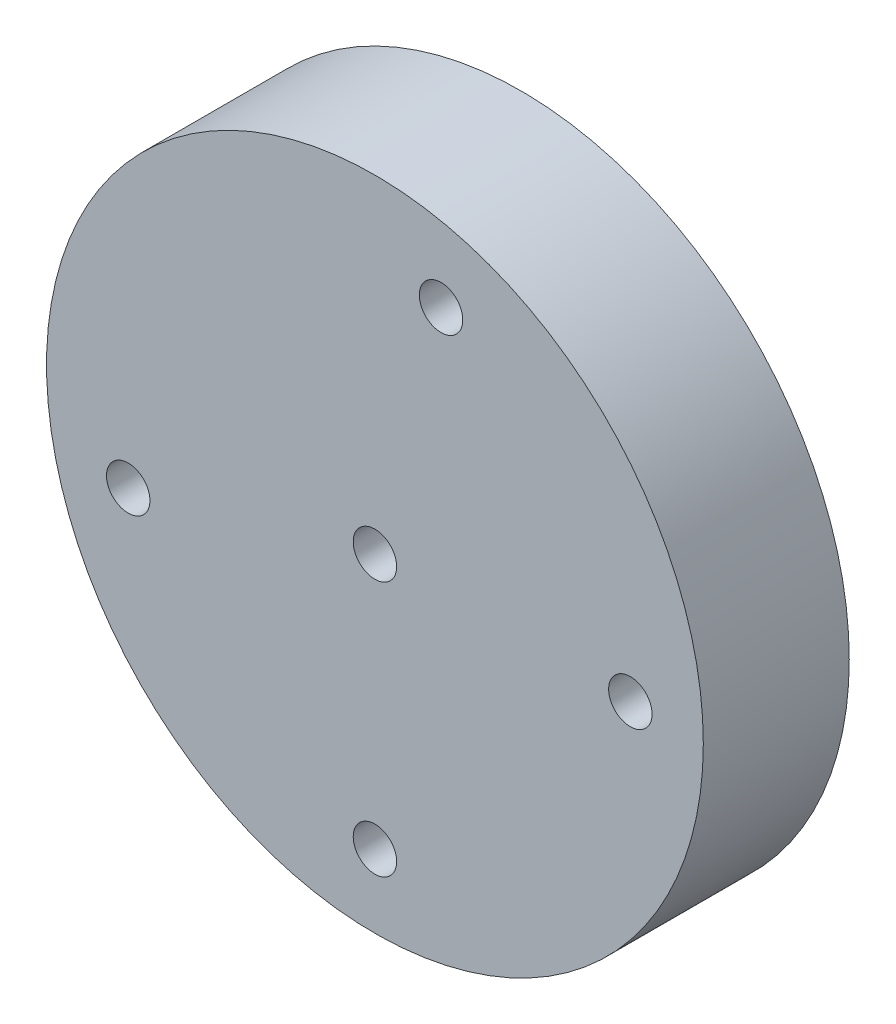
from build123d import *

# Parameters (mm, degrees)
SKETCH1_R           = 45
SKETCH1_R_2         = 2.9765625
BOSS_EXTRUDE1_DEPTH = 20


with BuildPart() as part:
    # Sketch1 → Boss-Extrude1 (new body)
    with BuildSketch(Plane.XY):
        Circle(SKETCH1_R)
        Circle(SKETCH1_R_2, mode=Mode.SUBTRACT)
        with Locations((9.058666579, 33.80740392)):
            Circle(SKETCH1_R_2, mode=Mode.SUBTRACT)
        with Locations((35, 0)):
            Circle(SKETCH1_R_2, mode=Mode.SUBTRACT)
        with Locations((0, -35)):
            Circle(SKETCH1_R_2, mode=Mode.SUBTRACT)
        with Locations((-33.80740392, -9.058666579)):
            Circle(SKETCH1_R_2, mode=Mode.SUBTRACT)
    extrude(amount=BOSS_EXTRUDE1_DEPTH)


solid = part.part
